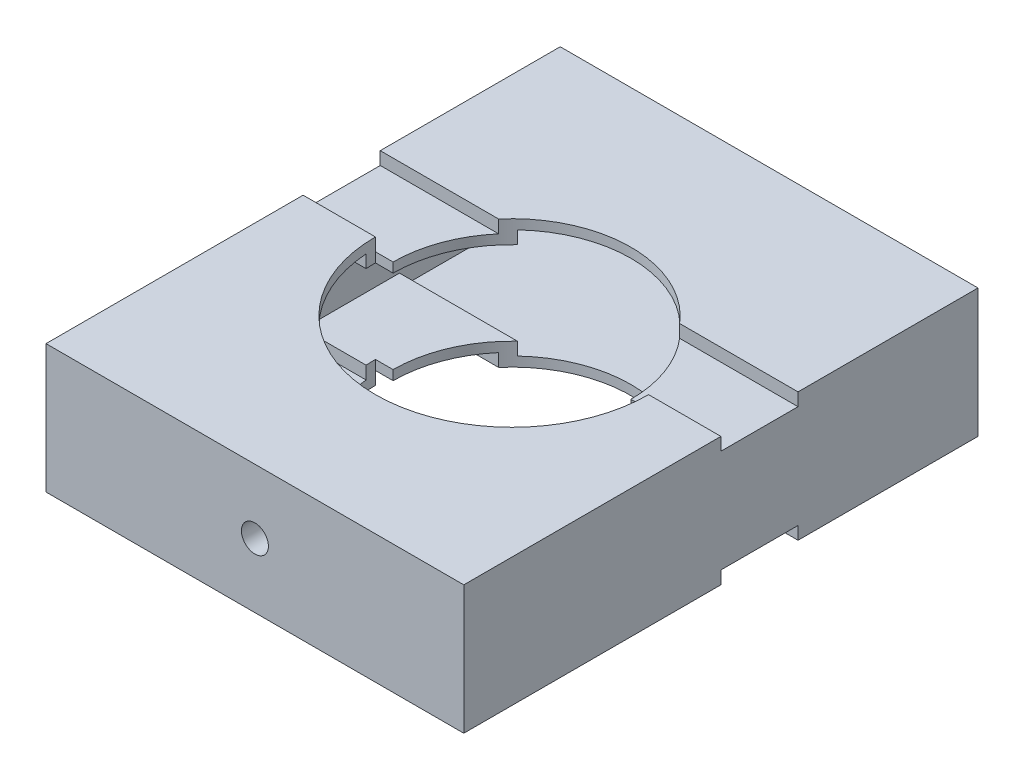
from build123d import *
from build123d.topology import SkipClean

# Parameters (mm, degrees)
SKETCH_1_W              = 65
SKETCH_1_H              = 80
EXTRUDE_1_DEPTH         = 20
CUT_EXTRUDE_1_DEPTH     = 56.283360969
SKETCH_3_R              = 18.5
CUT_EXTRUDE_2_DEPTH     = 56.283360969
SKETCH_4_R              = 6
CUT_EXTRUDE_3_DEPTH     = 37
CUT_EXTRUDE_4_REACH     = 90.635
SKETCH_5_R              = 2.1
SKETCH_6_W              = 65
SKETCH_6_H              = 12
CUT_EXTRUDE_5_DEPTH     = 2
SKETCH_7_W              = 65
SKETCH_7_H              = 12
CUT_EXTRUDE_6_DEPTH     = 2
SHELL_START             = -38.5
SHELL_1_DEPTH           = 77
SHELL_1_2_DEPTH         = 25
SHELL_START_2           = 1.5
SHELL_1_3_DEPTH         = 37
EXTRUDE_START           = 21.249883538
EXTRUDE_2_OUTLINE_W     = 22
EXTRUDE_2_OUTLINE_H     = 17
EXTRUDE_2_OUTLINE_R     = 7.5
EXTRUDE_2_OUTLINE_H_2   = 26.054315759
EXTRUDE_2_DEPTH         = 18.750116462
EXTRUDE_START_2         = 18.181377836
EXTRUDE_2_2_OUTLINE_W   = 22
EXTRUDE_2_2_OUTLINE_H   = 17
EXTRUDE_2_2_OUTLINE_H_2 = 26.054315759
EXTRUDE_2_2_DEPTH       = 3.068505702
EXTRUDE_START_3         = -26.054315759
EXTRUDE_2_3_DEPTH       = 44.554315759
SKETCH_9_W              = 21.818622164
SKETCH_9_H              = 26.054315759
CUT_EXTRUDE_7_DEPTH     = 65.583878559


with BuildPart() as part:
    # 草图1 → 凸台-拉伸1 (new body)
    with BuildSketch(Plane(origin=(0, 0, 0), x_dir=(1, 0, 0), z_dir=(0, 1, 0))):
        Rectangle(SKETCH_1_W, SKETCH_1_H)
    extrude(amount=EXTRUDE_1_DEPTH)

    # 草图2 → 切除-拉伸1 (cut, through all)
    with BuildSketch(Plane(origin=(0, 20, 0), x_dir=(1, 0, 0), z_dir=(0, 1, 0))):
        with BuildLine():
            Line((-21.25, 0), (21.25, 0))
            ThreePointArc((21.25, 0), (0, -21.25), (-21.25, 0))
        make_face()
    extrude(amount=-CUT_EXTRUDE_1_DEPTH, mode=Mode.SUBTRACT)

    # 草图3 → 切除-拉伸2 (cut, through all)
    with BuildSketch(Plane(origin=(0, 20, 0), x_dir=(-1, 0, 0), z_dir=(0, 1, 0))):
        Circle(SKETCH_3_R)
    extrude(amount=-CUT_EXTRUDE_2_DEPTH, mode=Mode.SUBTRACT)

    # 草图4 → 切除-拉伸3 (cut)
    with BuildSketch(Plane.XY):
        with Locations(Location((0, 10, 0), (0, 0, 180))):
            Circle(SKETCH_4_R)
    extrude(amount=CUT_EXTRUDE_3_DEPTH, mode=Mode.SUBTRACT)

    # 草图5 → 切除-拉伸4 (cut, up to next)
    with BuildSketch(Plane.XY.offset(40), mode=Mode.PRIVATE) as cut_extrude_4_sk1:
        with Locations((0, 10)):
            Circle(SKETCH_5_R)
    cut_extrude_4_tool1 = extrude(cut_extrude_4_sk1.sketch, amount=-CUT_EXTRUDE_4_REACH, mode=Mode.PRIVATE) & part.part
    add(cut_extrude_4_tool1.solids().sort_by_distance((0, 10, 40))[0], mode=Mode.SUBTRACT)

    # 草图6 → 切除-拉伸5 (cut)
    with BuildSketch(Plane(origin=(0, 20, 0), x_dir=(1, 0, 0), z_dir=(0, 1, 0))):
        with Locations((0, 6)):
            Rectangle(SKETCH_6_W, SKETCH_6_H)
    extrude(amount=-CUT_EXTRUDE_5_DEPTH, mode=Mode.SUBTRACT)

    # 草图7 → 切除-拉伸6 (cut)
    with BuildSketch(Plane.XZ):
        with Locations((0, -6)):
            Rectangle(SKETCH_7_W, SKETCH_7_H)
    extrude(amount=-CUT_EXTRUDE_6_DEPTH, mode=Mode.SUBTRACT)

    # 抽壳1: read off the stored shape, not the designer's step
    # 抽壳1 outline → 抽壳1 (cut)
    with BuildSketch(Plane.XY.offset(SHELL_START)):
        with BuildLine():
            Line((3.741657387, 3.5), (31, 3.5))
            Line((31, 3.5), (31, 16.5))
            Line((31, 16.5), (3.741657387, 16.5))
            ThreePointArc((3.741657387, 16.5), (7.5, 10), (3.741657387, 3.5))
        make_face()
        with BuildLine():
            Line((-31, 16.5), (-31, 3.5))
            Line((-31, 3.5), (-3.741657387, 3.5))
            ThreePointArc((-3.741657387, 3.5), (-7.5, 10), (-3.741657387, 16.5))
            Line((-3.741657387, 16.5), (-31, 16.5))
        make_face()
    extrude(amount=SHELL_1_DEPTH, mode=Mode.SUBTRACT)

    # Shell 1 2 outline → Shell 1 2 (cut)
    with BuildSketch(Plane.XY.offset(SHELL_START)):
        with BuildLine():
            Line((-31, 1.5), (31, 1.5))
            Line((31, 1.5), (31, 3.5))
            Line((31, 3.5), (3.741657387, 3.5))
            ThreePointArc((3.741657387, 3.5), (7.5, 10), (3.741657387, 16.5))
            Line((3.741657387, 16.5), (31, 16.5))
            Line((31, 16.5), (31, 18.5))
            Line((31, 18.5), (-31, 18.5))
            Line((-31, 18.5), (-31, 16.5))
            Line((-31, 16.5), (-3.741657387, 16.5))
            ThreePointArc((-3.741657387, 16.5), (-7.5, 10), (-3.741657387, 3.5))
            Line((-3.741657387, 3.5), (-31, 3.5))
            Line((-31, 3.5), (-31, 1.5))
        make_face()
    extrude(amount=SHELL_1_2_DEPTH, mode=Mode.SUBTRACT)

    # Shell 1 3 outline → Shell 1 3 (cut)
    with BuildSketch(Plane.XY.offset(SHELL_START_2)):
        with BuildLine():
            Line((-31, 1.5), (31, 1.5))
            Line((31, 1.5), (31, 3.5))
            Line((31, 3.5), (3.741657387, 3.5))
            ThreePointArc((3.741657387, 3.5), (0, 2.5), (-3.741657387, 3.5))
            Line((-3.741657387, 3.5), (-31, 3.5))
            Line((-31, 3.5), (-31, 1.5))
        make_face()
        with BuildLine():
            Line((3.741657387, 16.5), (31, 16.5))
            Line((31, 16.5), (31, 18.5))
            Line((31, 18.5), (-31, 18.5))
            Line((-31, 18.5), (-31, 16.5))
            Line((-31, 16.5), (-3.741657387, 16.5))
            ThreePointArc((-3.741657387, 16.5), (0, 17.5), (3.741657387, 16.5))
        make_face()
    extrude(amount=SHELL_1_3_DEPTH, mode=Mode.SUBTRACT)

    # 凸台-拉伸2: read off the stored shape, not the designer's step
    # 凸台-拉伸2 outline → 凸台-拉伸2 (add)
    # profile 1 of 2: a face of its own
    with BuildSketch(Plane.XY.offset(EXTRUDE_START)):
        with Locations((0, 10)):
            Rectangle(EXTRUDE_2_OUTLINE_W, EXTRUDE_2_OUTLINE_H)
        with Locations((0, 10)):
            Circle(EXTRUDE_2_OUTLINE_R, mode=Mode.SUBTRACT)
    # profile 2 of 2: a face of its own
    with BuildSketch(Plane.XY.offset(EXTRUDE_START)):
        with Locations((0, -13.02715788)):
            Rectangle(EXTRUDE_2_OUTLINE_W, EXTRUDE_2_OUTLINE_H_2)
    extrude(amount=EXTRUDE_2_DEPTH)

    # Extrude 2 2 outline → Extrude 2 2 (add)
    # profile 1 of 2: a face of its own
    with BuildSketch(Plane.XY.offset(EXTRUDE_START_2)):
        with Locations((0, 10)):
            Rectangle(EXTRUDE_2_2_OUTLINE_W, EXTRUDE_2_2_OUTLINE_H)
        with BuildLine():
            ThreePointArc((0.070228488, 2.50032881), (-5.676e-05, 2.5), (-0.070342004, 2.500329874))
            ThreePointArc((-0.070342004, 2.500329874), (-7.5, 10.000015586), (-0.070310835, 17.499670419))
            ThreePointArc((-0.070310835, 17.499670419), (-2.7611e-05, 17.5), (0.070255616, 17.499670936))
            ThreePointArc((0.070255616, 17.499670936), (7.5, 9.999986435), (0.070228488, 2.50032881))
        make_face(mode=Mode.SUBTRACT)
    # profile 2 of 2: a face of its own
    with BuildSketch(Plane.XY.offset(EXTRUDE_START_2)):
        with Locations((0, -13.02715788)):
            Rectangle(EXTRUDE_2_2_OUTLINE_W, EXTRUDE_2_2_OUTLINE_H_2)
    extrude(amount=EXTRUDE_2_2_DEPTH)

    # Extrude 2 3 outline → Extrude 2 3 (cut)
    with SkipClean():  # the faces are left unmerged after this step: merging them gives an invalid solid
        with BuildSketch(Plane(origin=(0, 0, 0), x_dir=(1, 0, 0), z_dir=(0, 1, 0)).offset(EXTRUDE_START_3)):
            with BuildLine():
                Line((11, -18.181377836), (-11, -18.181377836))
                ThreePointArc((-11, -18.181377836), (0, -21.25), (11, -18.181377836))
            make_face()
        extrude(amount=EXTRUDE_2_3_DEPTH, mode=Mode.SUBTRACT)

    # 草图9 → 切除-拉伸7 (cut, through all)
    with SkipClean():  # the faces are left unmerged after this step: merging them gives an invalid solid
        with BuildSketch(Plane(origin=(11, 0, 0), x_dir=(0, 0, -1), z_dir=(1, 0, 0))):
            with Locations((-29.090688918, -13.02715788)):
                Rectangle(SKETCH_9_W, SKETCH_9_H)
        extrude(amount=-CUT_EXTRUDE_7_DEPTH, mode=Mode.SUBTRACT)


solid = part.part
